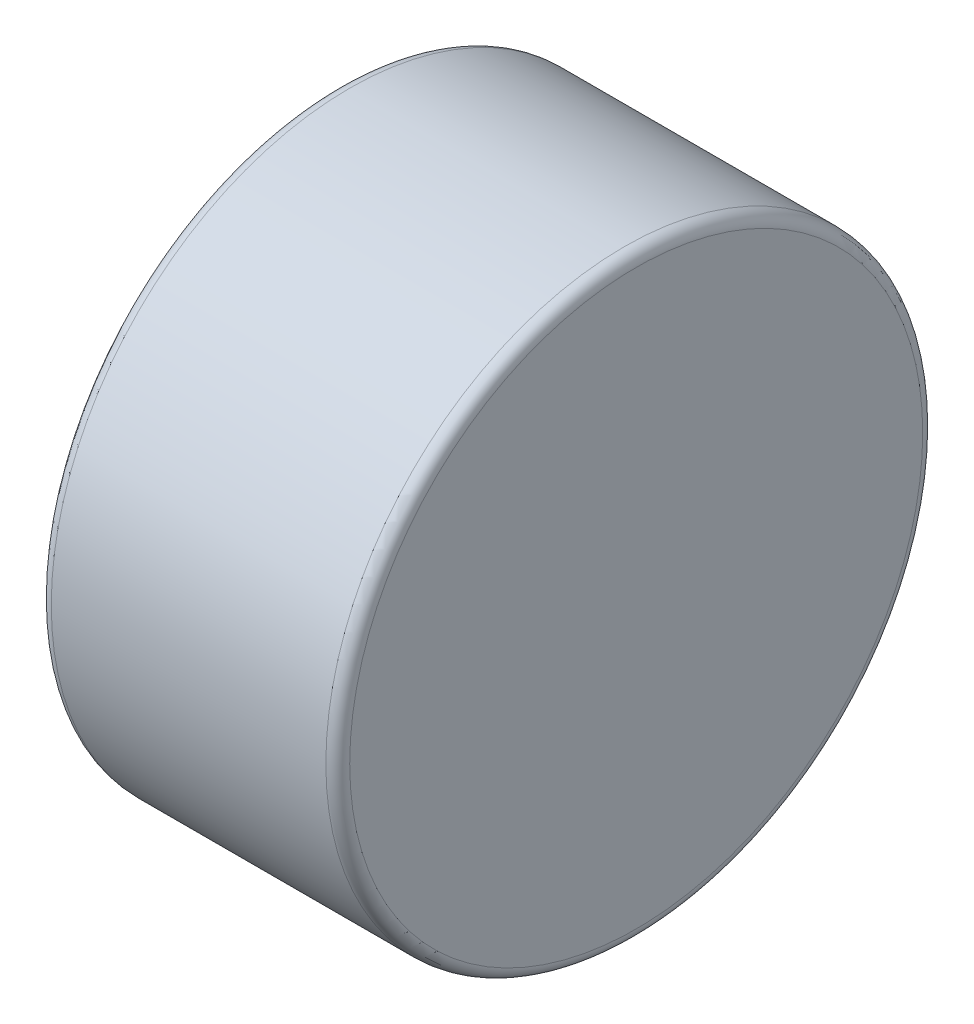
from build123d import *

# Parameters (mm, degrees)
SKETCH1_R           = 5
BOSS_EXTRUDE1_DEPTH = 2.5
FILLET1_R           = 0.2


with BuildPart() as part:
    # Sketch1 → Boss-Extrude1 (new, symmetric)
    with BuildSketch(Plane(origin=(0, 0, 0), x_dir=(0, 0, -1), z_dir=(1, 0, 0))):
        Circle(SKETCH1_R)
    extrude(amount=BOSS_EXTRUDE1_DEPTH, both=True)

    # Fillet1
    fillet1_edges = [part.edges().sort_by_distance(p)[0] for p in [
        (2.5, 0, 5),
        (-2.5, 0, 5),
    ]]
    fillet(fillet1_edges, radius=FILLET1_R)


solid = part.part
